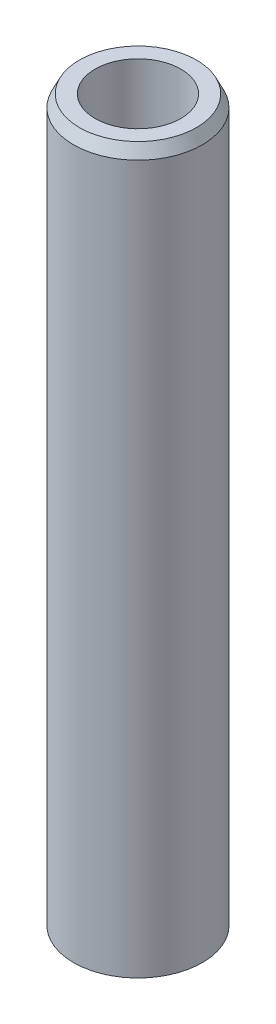
from build123d import *
from OCP.BRepFilletAPI import BRepFilletAPI_MakeChamfer

# Parameters (mm, degrees)
SKETCH1_R           = 27.5
BOSS_EXTRUDE1_DEPTH = 310.015966125
SKETCH2_R           = 18.305791165
CUT_EXTRUDE1_DEPTH  = 313.44583411
CHAMFER1_SIZE       = 5.122299414
CHAMFER1_SIZE2      = 2.506135458


with BuildPart() as part:
    # Sketch1 → Boss-Extrude1 (new body)
    with BuildSketch(Plane(origin=(0, 0, 0), x_dir=(1, 0, 0), z_dir=(0, 1, 0))):
        Circle(SKETCH1_R)
    extrude(amount=BOSS_EXTRUDE1_DEPTH)

    # Sketch2 → Cut-Extrude1 (cut, through all)
    with BuildSketch(Plane(origin=(0, 0, 0), x_dir=(1, 0, 0), z_dir=(0, 1, 0))):
        Circle(SKETCH2_R)
    extrude(amount=CUT_EXTRUDE1_DEPTH, mode=Mode.SUBTRACT)

    # Chamfer1: one chamfer whose edges measure the first distance from different faces: ONE call of the kernel's chamfer builder (chamfer() names one face for all edges)
    chamfer1_edges_1 = [part.edges().sort_by_distance(p)[0] for p in [
        (-27.5, 310.015966125, 0),
    ]]
    chamfer1_side_1 = [part.faces().sort_by_distance(p)[0] for p in [
        (-27.5, 155.007983063, 0),
    ]]
    chamfer1_edges_2 = [part.edges().sort_by_distance(p)[0] for p in [
        (-27.5, 0, 0),
    ]]
    chamfer1_side_2 = [part.faces().sort_by_distance(p)[0] for p in [
        (-26.722182541, 0, 0),
    ]]
    chamfer1 = BRepFilletAPI_MakeChamfer(part.part.solid().wrapped)
    for e in chamfer1_edges_1:
        chamfer1.Add(CHAMFER1_SIZE, CHAMFER1_SIZE2, e.wrapped, chamfer1_side_1[0].wrapped)  # the first distance lies on this face
    for e in chamfer1_edges_2:
        chamfer1.Add(CHAMFER1_SIZE, CHAMFER1_SIZE2, e.wrapped, chamfer1_side_2[0].wrapped)  # the first distance lies on this face
    add(Compound.cast(chamfer1.Shape()), mode=Mode.REPLACE)


solid = part.part
